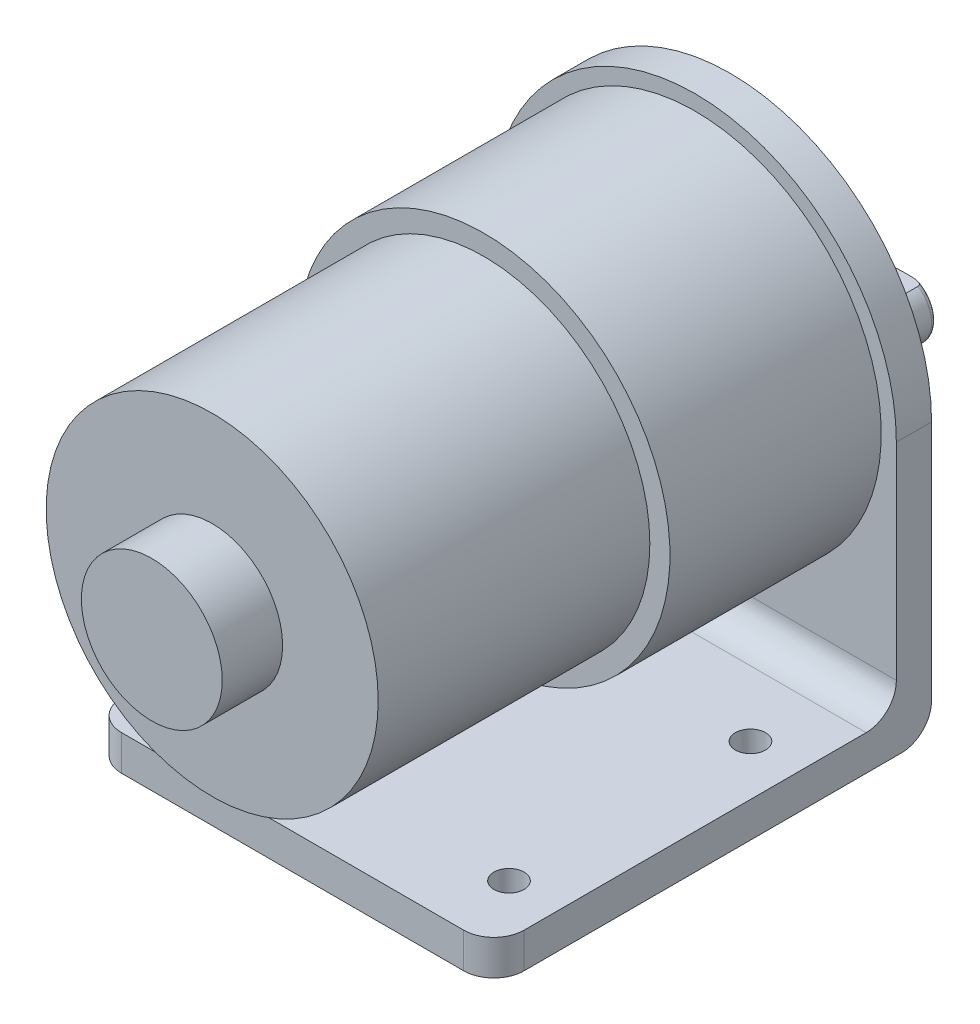
from build123d import *

# Parameters (mm, degrees)
SKETCH1_R           = 18.5
BOSS_EXTRUDE1_DEPTH = 21
SKETCH2_R           = 16.5
BOSS_EXTRUDE2_DEPTH = 27
SKETCH3_R           = 7
BOSS_EXTRUDE3_DEPTH = 6
BOSS_EXTRUDE4_DEPTH = 3.5
SKETCH5_W           = 40
SKETCH5_H           = 3.5
BOSS_EXTRUDE5_DEPTH = 40
FILLET1_R           = 3
SKETCH6_R           = 6
BOSS_EXTRUDE6_DEPTH = 6
SKETCH7_R           = 3
BOSS_EXTRUDE7_DEPTH = 15
FILLET2_R           = 0.5
CUT_EXTRUDE1_START  = -12
CUT_EXTRUDE1_DEPTH  = 12
CUT_EXTRUDE2_REACH  = 76.33
SKETCH9_R           = 1.5


with BuildPart() as part:
    # Sketch1 → Boss-Extrude1 (new body)
    with BuildSketch(Plane.XY):
        Circle(SKETCH1_R)
    extrude(amount=BOSS_EXTRUDE1_DEPTH)

    # Sketch2 → Boss-Extrude2 (add)
    with BuildSketch(Plane.XY.offset(21)):
        Circle(SKETCH2_R)
    extrude(amount=BOSS_EXTRUDE2_DEPTH)

    # Sketch3 → Boss-Extrude3 (add)
    with BuildSketch(Plane.XY.offset(48)):
        Circle(SKETCH3_R)
    extrude(amount=BOSS_EXTRUDE3_DEPTH)

    # Sketch4 → Boss-Extrude4 (add)
    with BuildSketch(Plane(origin=(0, 0, 0), x_dir=(-1, 0, 0), z_dir=(0, 0, -1))):
        with BuildLine():
            Line((-20, 0), (-20, -27))
            Line((-20, -27), (20, -27))
            Line((20, -27), (20, 0))
            ThreePointArc((20, 0), (0, 20), (-20, 0))
        make_face()
        with BuildLine():
            Line((6.5, 5), (6.5, -8.5))
            ThreePointArc((6.5, -8.5), (0, -15), (-6.5, -8.5))
            Line((-6.5, -8.5), (-6.5, 5))
            ThreePointArc((-6.5, 5), (0, 11.5), (6.5, 5))
        make_face(mode=Mode.SUBTRACT)
    extrude(amount=BOSS_EXTRUDE4_DEPTH)

    # Sketch5 → Boss-Extrude5 (add)
    with BuildSketch(Plane.XY):
        with Locations((0, -25.25)):
            Rectangle(SKETCH5_W, SKETCH5_H)
    extrude(amount=BOSS_EXTRUDE5_DEPTH)

    # Fillet1
    fillet1_edges = [part.edges().sort_by_distance(p)[0] for p in [
        (0, -27, -3.5),
        (0, -23.5, 0),
        (-20, -25.25, 40),
        (20, -25.25, 40),
    ]]
    fillet(fillet1_edges, radius=FILLET1_R)

    # Sketch6 → Boss-Extrude6 (add)
    with BuildSketch(Plane(origin=(0, 0, 0), x_dir=(-1, 0, 0), z_dir=(0, 0, -1))):
        with Locations((0, -8.5)):
            Circle(SKETCH6_R)
    extrude(amount=BOSS_EXTRUDE6_DEPTH)

    # Sketch7 → Boss-Extrude7 (add)
    with BuildSketch(Plane(origin=(0, 0, -6), x_dir=(-1, 0, 0), z_dir=(0, 0, -1))):
        with Locations((0, -8.5)):
            Circle(SKETCH7_R)
    extrude(amount=BOSS_EXTRUDE7_DEPTH)

    # Fillet2
    fillet2_edges = [part.edges().sort_by_distance(p)[0] for p in [
        (3, -8.5, -21),
    ]]
    fillet(fillet2_edges, radius=FILLET2_R)

    # Sketch8 → Cut-Extrude1 (cut)
    with BuildSketch(Plane(origin=(0, 0, -21), x_dir=(-1, 0, 0), z_dir=(0, 0, -1)).offset(CUT_EXTRUDE1_START)):
        with BuildLine():
            Line((-1.658312395, -6), (1.658312395, -6))
            ThreePointArc((1.658312395, -6), (0, -5.5), (-1.658312395, -6))
        make_face()
    extrude(amount=CUT_EXTRUDE1_DEPTH, mode=Mode.SUBTRACT)

    # Sketch9 → Cut-Extrude2 (cut, up to next)
    with BuildSketch(Plane.XZ.offset(27), mode=Mode.PRIVATE) as cut_extrude2_sk1:
        with Locations((15, 33.5)):
            Circle(SKETCH9_R)
    cut_extrude2_tool1 = extrude(cut_extrude2_sk1.sketch, amount=-CUT_EXTRUDE2_REACH, mode=Mode.PRIVATE) & part.part
    # Sketch9 → Cut-Extrude2 (cut, up to next)
    with BuildSketch(Plane.XZ.offset(27), mode=Mode.PRIVATE) as cut_extrude2_sk2:
        with Locations((15, 9.5)):
            Circle(SKETCH9_R)
    cut_extrude2_tool2 = extrude(cut_extrude2_sk2.sketch, amount=-CUT_EXTRUDE2_REACH, mode=Mode.PRIVATE) & part.part
    # Sketch9 → Cut-Extrude2 (cut, up to next)
    with BuildSketch(Plane.XZ.offset(27), mode=Mode.PRIVATE) as cut_extrude2_sk3:
        with Locations((-15, 33.5)):
            Circle(SKETCH9_R)
    cut_extrude2_tool3 = extrude(cut_extrude2_sk3.sketch, amount=-CUT_EXTRUDE2_REACH, mode=Mode.PRIVATE) & part.part
    # Sketch9 → Cut-Extrude2 (cut, up to next)
    with BuildSketch(Plane.XZ.offset(27), mode=Mode.PRIVATE) as cut_extrude2_sk4:
        with Locations((-15, 9.5)):
            Circle(SKETCH9_R)
    cut_extrude2_tool4 = extrude(cut_extrude2_sk4.sketch, amount=-CUT_EXTRUDE2_REACH, mode=Mode.PRIVATE) & part.part
    add(cut_extrude2_tool1.solids().sort_by_distance((15, -27, 33.5))[0], mode=Mode.SUBTRACT)
    add(cut_extrude2_tool2.solids().sort_by_distance((15, -27, 9.5))[0], mode=Mode.SUBTRACT)
    add(cut_extrude2_tool3.solids().sort_by_distance((-15, -27, 33.5))[0], mode=Mode.SUBTRACT)
    add(cut_extrude2_tool4.solids().sort_by_distance((-15, -27, 9.5))[0], mode=Mode.SUBTRACT)


solid = part.part
